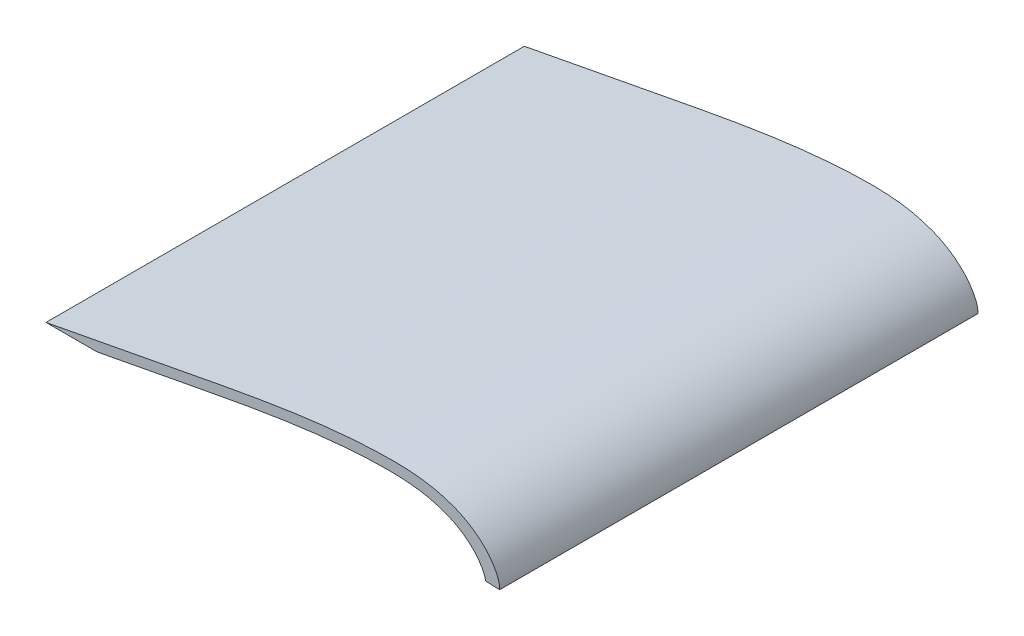
from build123d import *

# Parameters (mm, degrees)
BOSS_EXTRUDE1_DEPTH             = 50
BOSS_EXTRUDE2_REACH             = 72.874
SKETCH4_R                       = 4.9
BOSS_EXTRUDE2_DIRECTION_2_DEPTH = 0.46
CUT_EXTRUDE2_DEPTH              = 5


with BuildPart() as part:
    # Sketch3 → Boss-Extrude1 (new, symmetric)
    with BuildSketch(Plane.XY):
        with BuildLine():
            Line((-46.126968972, 0.978621832), (-35.415500388, 0.978621832))
            add(Edge.make_bspline(
                [(-35.415500388, 0.978621832), (-31.900717337, 1.646356284), (-28.385669806, 2.312644878), (-21.356250818, 3.648918025), (-17.842575491, 4.322708179), (-10.812262333, 5.654093081), (-7.296066509, 6.314104196), (-0.246237667, 7.538800854), (3.289652388, 8.100927369), (10.382593906, 9.05560756), (13.939655637, 9.449931283), (19.294779383, 9.845985299), (21.080534176, 9.94564859), (24.654054204, 10.053814529), (26.441812496, 10.062631968), (29.126639881, 9.931214403), (30.021142665, 9.862531806), (31.793464098, 9.656084843), (32.672832664, 9.517565102), (34.414963225, 9.15422751), (35.277930032, 8.930473985), (36.558652221, 8.523504326), (36.984484861, 8.375558226), (37.823491014, 8.056379668), (38.649942038, 7.713371742), (39.445605832, 7.311930302), (40.222624744, 6.875101272), (40.601901137, 6.639162596), (41.343034868, 6.13422425), (41.706577137, 5.864403259), (42.405097582, 5.299009429), (42.740435419, 5.002707871), (43.379039637, 4.378765248), (43.682854505, 4.051660151), (44.248370211, 3.356297071), (44.509109318, 2.983679064), (44.864883627, 2.405343349), (44.977987263, 2.209593987), (45.193994648, 1.812573614), (45.296445183, 1.611057258), (45.481130702, 1.197080973), (45.56357233, 0.983774864), (45.690582147, 0.549932416), (45.735539216, 0.328490722), (45.752720851, 0.100279614)],
                knots=[0, 0, 0, 0, 0.125, 0.125, 0.25, 0.25, 0.375, 0.375, 0.5, 0.5, 0.625, 0.625, 0.6875, 0.6875, 0.75, 0.75, 0.78125, 0.78125, 0.8125, 0.8125, 0.84375, 0.84375, 0.859375, 0.859375, 0.875, 0.890625, 0.890625, 0.90625, 0.90625, 0.921875, 0.921875, 0.9375, 0.9375, 0.953125, 0.953125, 0.96875, 0.96875, 0.9765625, 0.9765625, 0.984375, 0.984375, 0.9921875, 0.9921875, 1, 1, 1, 1], degree=3))
            Line((45.752720851, 0.100279614), (48.72072986, 0))
            add(Edge.make_bspline(
                [(48.72072986, 0), (48.741252965, 1.211959263), (48.046357201, 2.857215342), (46.815105861, 4.78389108), (45.492517633, 6.302382051), (43.826843254, 7.740810658), (41.494622603, 9.264300756), (38.168076465, 10.717178582), (33.78869279, 11.831530653), (28.729432589, 12.255898832), (23.71704668, 12.218808276), (17.039017695, 11.857586647), (8.690276234, 10.974271434), (-1.304085126, 9.447886993), (-11.287660735, 7.611152922), (-21.278620725, 5.696721586), (-32.895483349, 3.494457071), (-41.17773966, 1.91909956), (-46.126968972, 0.978621832)],
                knots=[0, 0, 0, 0, 0.032626759, 0.049882871, 0.06427589, 0.089250813, 0.111667998, 0.142584384, 0.191135501, 0.238340392, 0.285329255, 0.332381604, 0.426846937, 0.521876031, 0.61736406, 0.713023045, 0.80868203, 0.950714186, 0.950714186, 0.950714186, 0.950714186], degree=3))
        make_face()
    extrude(amount=BOSS_EXTRUDE1_DEPTH, both=True)

    # Sketch4 → Boss-Extrude2 (add, up to next)
    with BuildSketch(Plane(origin=(0, 0, 0), x_dir=(1, 0, 0), z_dir=(0, 1, 0)), mode=Mode.PRIVATE) as boss_extrude2_sk1:
        with Locations((-13.27927014, 0)):
            Circle(SKETCH4_R)
    boss_extrude2_tool1 = extrude(boss_extrude2_sk1.sketch, amount=BOSS_EXTRUDE2_REACH, mode=Mode.PRIVATE) - part.part
    add(boss_extrude2_tool1.solids().sort_by_distance((-13.27927, 0, 0))[0])

    # Sketch4 → Boss-Extrude2 direction 2 (add)
    with BuildSketch(Plane(origin=(0, 0, 0), x_dir=(1, 0, 0), z_dir=(0, 1, 0))):
        with Locations((-13.27927014, 0)):
            Circle(SKETCH4_R)
    extrude(amount=-BOSS_EXTRUDE2_DIRECTION_2_DEPTH)

    # Sketch6 → Cut-Revolve1 (revolve, cut)
    with BuildSketch(Plane.XY):
        Polygon((-13.27927014, 3.54), (-13.27927014, -0.46), (-11.77927014, -0.46), (-11.77927014, 1.54), (-10.27927014, 1.54), (-10.27927014, 3.54), align=None)
    revolve(axis=Axis((-13.27927014, -0.46, 0), (0, 1, 0)), mode=Mode.SUBTRACT)

    # Sketch8 → Cut-Extrude2 (cut)
    with BuildSketch(Plane(origin=(-13.27927014, 0, 0), x_dir=(0, 0, -1), z_dir=(1, 0, 0))):
        Polygon((-1, 1.54), (-1, -0.46), (1, -0.46), (1, 1.54), (3, 1.54), (3, 3.54), (-3, 3.54), (-3, 1.54), align=None)
    extrude(amount=-CUT_EXTRUDE2_DEPTH, mode=Mode.SUBTRACT)


solid = part.part
